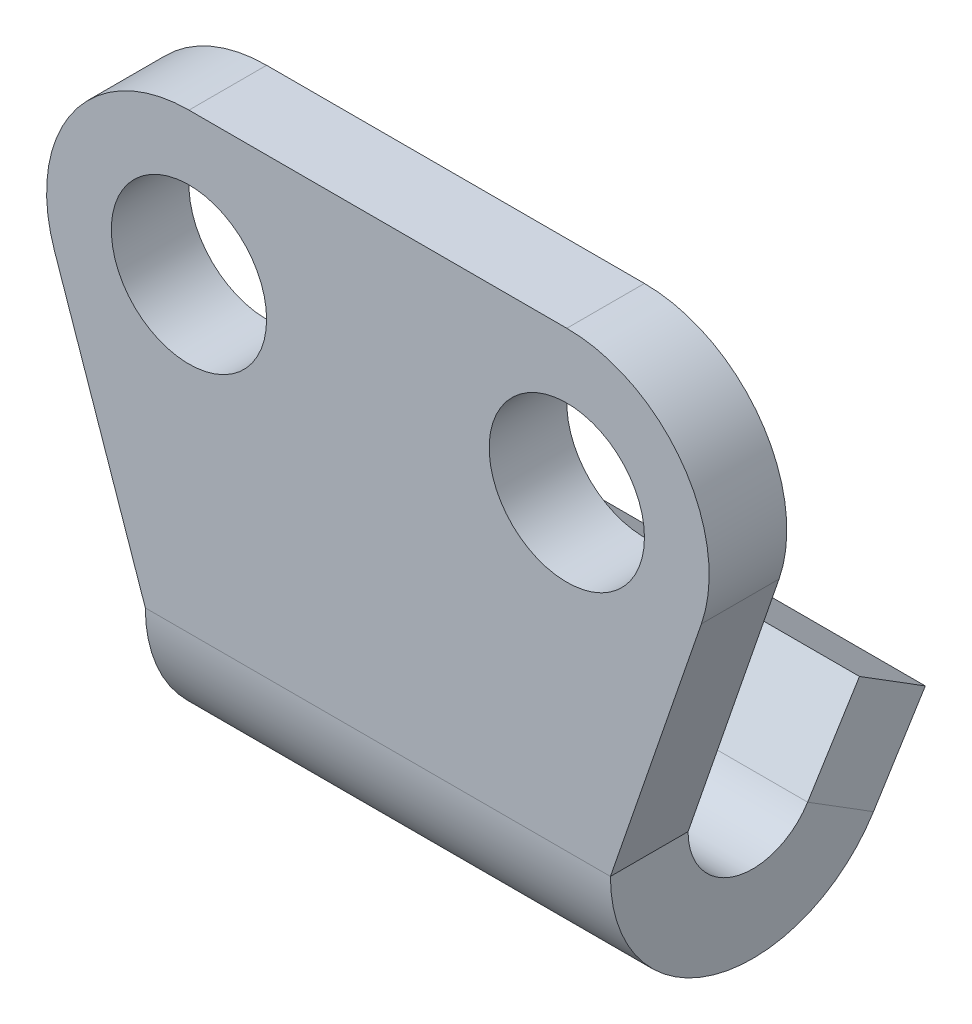
from build123d import *

# Parameters (mm, degrees)
SCHIZZO2_R               = 3
BASE_FLANGIA1_DEPTH      = 3
BORDO_FLANGIA3_DEPTH     = 17.969964774
TAGLIO_ESTRUSIONE1_DEPTH = 35.433191913


# Sheet-metal steps are written as plain solids
with BuildPart() as part:
    # Schizzo2 → Base-Flangia1 (new body)
    with BuildSketch(Plane.XY):
        with BuildLine():
            Line((-7.3, 0), (7.3, 0))
            ThreePointArc((7.3, 0), (11.777635351, -2.306133744), (12.500352166, -7.29062485))
            Line((12.500352166, -7.29062485), (8.984982387, -17.5))
            Line((8.984982387, -17.5), (-8.984982387, -17.5))
            Line((-8.984982387, -17.5), (-12.500352166, -7.29062485))
            ThreePointArc((-12.500352166, -7.29062485), (-11.777635351, -2.306133744), (-7.3, 0))
        make_face()
        with Locations((-7.3, -5.5)):
            Circle(SCHIZZO2_R, mode=Mode.SUBTRACT)
        with Locations((7.3, -5.5)):
            Circle(SCHIZZO2_R, mode=Mode.SUBTRACT)
    extrude(amount=-BASE_FLANGIA1_DEPTH)

    # Bordo-Flangia3 section (across the edge) → Bordo-Flangia3 (add)
    with BuildSketch(Plane(origin=(8.984982387, -26.21853611, -3), x_dir=(0, 0.529919264233206, 0.8480480961564254), z_dir=(-1, 0, 0))):
        with BuildLine():
            Line((-3, 8.71853611), (-3, 15))
            Line((-3, 15), (0, 15))
            Line((0, 15), (0, 8.71853611))
            ThreePointArc((0, 8.71853611), (1.81090661, 6.31538187), (4.62012024, 7.393737949))
            Line((4.62012024, 7.393737949), (7.164264529, 5.803980156))
            ThreePointArc((7.164264529, 5.803980156), (0.983994543, 3.431596782), (-3, 8.71853611))
        make_face()
    extrude(amount=BORDO_FLANGIA3_DEPTH)

    # Schizzo25 → Taglio-Estrusione1 (cut, through all)
    with BuildSketch(Plane(origin=(8.984982387, 0, 0), x_dir=(0, 0, -1), z_dir=(1, 0, 0))):
        Polygon((9.623215059, -15.619176357), (10.948788963, -13.497814667), (13.492933252, -15.08757246), (12.167359348, -17.20893415), align=None)
    extrude(amount=-TAGLIO_ESTRUSIONE1_DEPTH, mode=Mode.SUBTRACT)


solid = part.part
